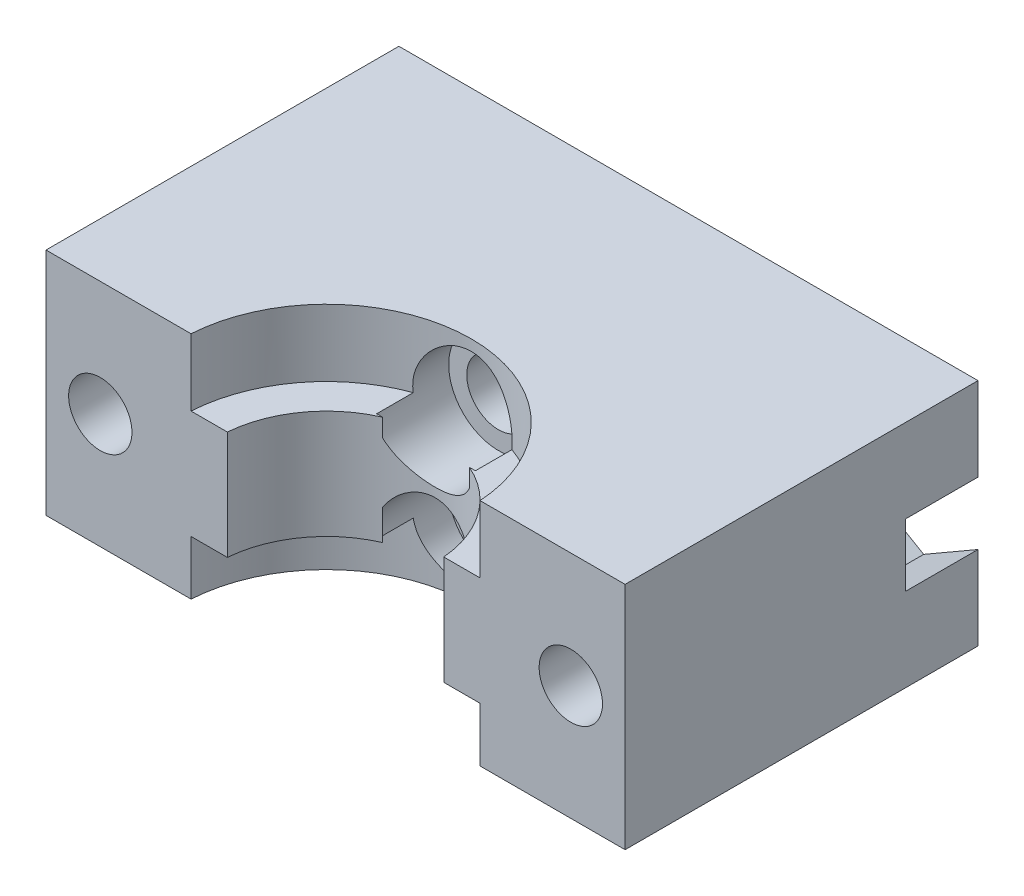
from build123d import *

# Parameters (mm, degrees)
SKETCH2_W           = 32
SKETCH2_H           = 12.7
SKETCH2_R           = 1.75
BOSS_EXTRUDE1_DEPTH = 19.5
SKETCH3_R           = 1.75
CUT_EXTRUDE1_DEPTH  = 27.011007285
CUT_EXTRUDE2_DEPTH  = 4
SKETCH5_R           = 8
CUT_EXTRUDE3_DEPTH  = 3.7
SKETCH9_R           = 6
CUT_EXTRUDE5_DEPTH  = 6
SKETCH10_R          = 8
CUT_EXTRUDE6_DEPTH  = 28.02480353
SKETCH6_R           = 2.75
CUT_EXTRUDE4_DEPTH  = 4


with BuildPart() as part:
    # Sketch2 → Boss-Extrude1 (new body)
    with BuildSketch(Plane.XY):
        Rectangle(SKETCH2_W, SKETCH2_H)
        with Locations((0, 3)):
            Circle(SKETCH2_R, mode=Mode.SUBTRACT)
        with Locations((0, -3)):
            Circle(SKETCH2_R, mode=Mode.SUBTRACT)
    extrude(amount=BOSS_EXTRUDE1_DEPTH)

    # Sketch3 → Cut-Extrude1 (cut, through all)
    with BuildSketch(Plane.XY.offset(19.5)):
        with Locations((-13, 0)):
            Circle(SKETCH3_R)
        with Locations((13, 0)):
            Circle(SKETCH3_R)
    extrude(amount=-CUT_EXTRUDE1_DEPTH, mode=Mode.SUBTRACT)

    # Sketch4 → Cut-Extrude2 (cut)
    with BuildSketch(Plane(origin=(0, 0, 0), x_dir=(-1, 0, 0), z_dir=(0, 0, -1))):
        Polygon((-10, -1.732050808), (-10, 1.732050808), (-13, 3.464101615), (-16, 1.732050808), (-16, -1.732050808), (-13, -3.464101615), align=None)
        Polygon((13, -3.464101615), (16, -1.732050808), (16, 1.732050808), (13, 3.464101615), (10, 1.732050808), (10, -1.732050808), align=None)
    extrude(amount=-CUT_EXTRUDE2_DEPTH, mode=Mode.SUBTRACT)

    # Sketch5 → Cut-Extrude3 (cut)
    with BuildSketch(Plane(origin=(0, 6.35, 0), x_dir=(1, 0, 0), z_dir=(0, 1, 0))):
        with Locations((0, -20)):
            Circle(SKETCH5_R)
    extrude(amount=-CUT_EXTRUDE3_DEPTH, mode=Mode.SUBTRACT)

    # Sketch9 → Cut-Extrude5 (cut)
    with BuildSketch(Plane(origin=(0, 2.65, 0), x_dir=(1, 0, 0), z_dir=(0, 1, 0))):
        with Locations((0, -20)):
            Circle(SKETCH9_R)
    extrude(amount=-CUT_EXTRUDE5_DEPTH, mode=Mode.SUBTRACT)

    # Sketch10 → Cut-Extrude6 (cut, through all)
    with BuildSketch(Plane(origin=(0, -3.35, 0), x_dir=(1, 0, 0), z_dir=(0, 1, 0))):
        with Locations((0, -20)):
            Circle(SKETCH10_R)
    extrude(amount=-CUT_EXTRUDE6_DEPTH, mode=Mode.SUBTRACT)

    # Sketch6 → Cut-Extrude4 (cut)
    with BuildSketch(Plane.XY.offset(14.5)):
        with Locations((0, 3)):
            Circle(SKETCH6_R)
        with Locations((0, -3)):
            Circle(SKETCH6_R)
    extrude(amount=-CUT_EXTRUDE4_DEPTH, mode=Mode.SUBTRACT)


solid = part.part
